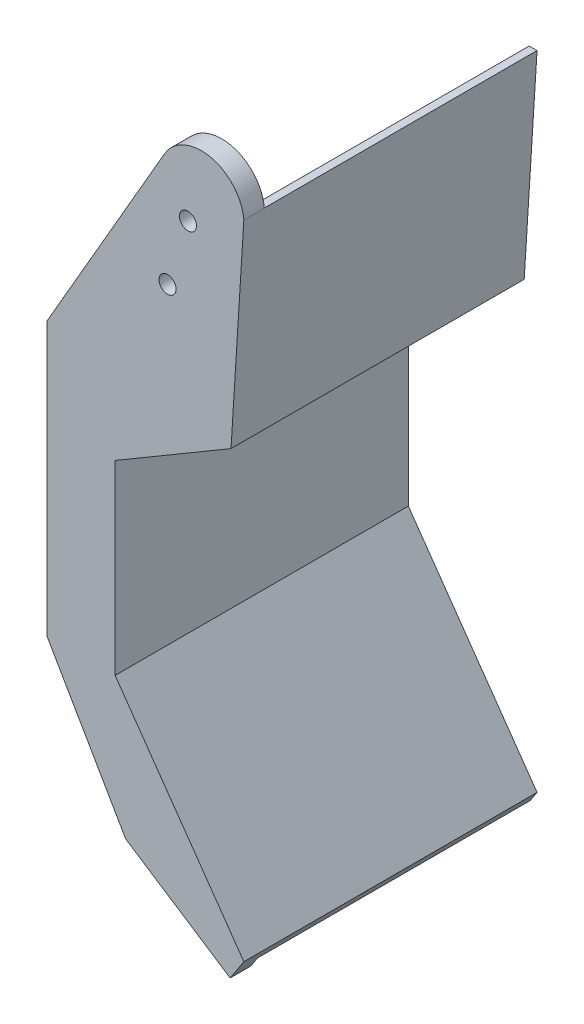
from build123d import *

# Parameters (mm, degrees)
EXTRUDE_4_DEPTH     = 3
EXTRUDE_6_DEPTH     = 40
EXTRUDE_7_DEPTH     = 40
EXTRUDE_8_DEPTH     = 40
SKETCH_12_R         = 1.25
CUT_EXTRUDE_1_DEPTH = 84.75473517


with BuildPart() as part:
    # 草图1 → 凸台-拉伸4 (new body)
    with BuildSketch(Plane.XY):
        with BuildLine():
            ThreePointArc((11.999755772, 64.190702015), (7.19287537, 69.699227744), (0.441332655, 66.894477154))
            Line((0.441332655, 66.894477154), (-16.87917542, 36.894477154))
            Line((-16.87917542, 36.894477154), (-16.87917542, -3.105522846))
            Line((-16.87917542, -3.105522846), (-5.332170037, -23.105522846))
            Line((-5.332170037, -23.105522846), (9.992741519, -33.105522846))
            Line((9.992741519, -33.105522846), (11.999755772, -30.029791253))
            Line((11.999755772, -30.029791253), (-6.87917542, -3.105522846))
            Line((-6.87917542, -3.105522846), (-6.87917542, 14.190702015))
            Line((-6.87917542, 14.190702015), (-6.87917542, 24.190702015))
            Line((-6.87917542, 24.190702015), (10.114332844, 34.190702015))
            Line((10.114332844, 34.190702015), (11.999755772, 64.190702015))
        make_face()
    extrude(amount=EXTRUDE_4_DEPTH)

    # 草图6 → 凸台-拉伸6 (add)
    with BuildSketch(Plane(origin=(0, 0, 0), x_dir=(-1, 0, 0), z_dir=(0, 0, -1))):
        Polygon((6.87917542, 24.190702015), (8.248400541, 24.190702015), (8.248400541, -3.145484966), (-10.996248645, -31.567657049), (-11.999755772, -30.029791253), (6.87917542, -3.105522846), align=None)
    extrude(amount=EXTRUDE_6_DEPTH)

    # 草图7 → 凸台-拉伸7 (add)
    with BuildSketch(Plane(origin=(0, 0, 0), x_dir=(-1, 0, 0), z_dir=(0, 0, -1))):
        Polygon((-10.114332844, 34.190702015), (6.87917542, 24.190702015), (8.248400541, 24.190702015), (8.248400541, 25.705558388), (-9.10000484, 35.914401148), align=None)
    extrude(amount=EXTRUDE_7_DEPTH)

    # 草图8 → 凸台-拉伸8 (add)
    with BuildSketch(Plane(origin=(0, 0, 0), x_dir=(-1, 0, 0), z_dir=(0, 0, -1))):
        Polygon((-11.999755772, 64.190702015), (-10.843969952, 64.190702015), (-9.10000484, 37.381254093), (-9.607168842, 35.052551582), (-10.114332844, 34.190702015), align=None)
    extrude(amount=EXTRUDE_8_DEPTH)

    # 草图12 → 切除-拉伸1 (cut, through all)
    with BuildSketch(Plane.XY.offset(3)):
        with Locations((3.800097921, 59.941254798)):
            Circle(SKETCH_12_R)
        with Locations((0.805454014, 50.400180023)):
            Circle(SKETCH_12_R)
    extrude(amount=-CUT_EXTRUDE_1_DEPTH, mode=Mode.SUBTRACT)


solid = part.part
